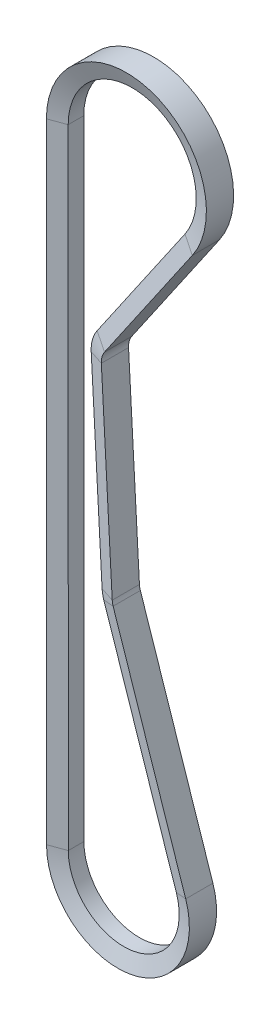
from build123d import *


with BuildPart() as part:
    # Sweep1: sweep along a path in Sketch2
    with BuildLine(Plane.XY) as sweep1_path:
        Line((-24.999999529, -0.004853431), (-25.042705751, 219.974686927))
        ThreePointArc((-25.042705751, 219.974686927), (11.26478038, 246.719338641), (26.024617616, 204.108810022))
        Line((26.024617616, 204.108810022), (-4.705730871, 159.445402954))
        ThreePointArc((-4.705730871, 159.445402954), (-5.587299935, 157.564983252), (-5.81499475, 155.500692249))
        Line((-5.81499475, 155.500692249), (-2.008276718, 85.604276763))
        ThreePointArc((-2.008276718, 85.604276763), (-1.90524448, 84.759976186), (-1.690298853, 83.937019635))
        Line((-1.690298853, 83.937019635), (23.71112417, 7.923546593))
        ThreePointArc((23.71112417, 7.923546593), (4.016239741, -24.675287604), (-24.999999529, -0.004853431))
    # Sketch3 → Sweep1 (sweep)
    with BuildSketch(Plane(origin=(23.71112417, 7.923546593, 0), x_dir=(-0.9484449667827561, -0.3169418637297014, 0), z_dir=(0.3169418637297014, -0.9484449667827561, 0))):
        Polygon((0, -4.7625), (0, 4.7625), (5.588, 2.728634331), (5.588, -2.728634331), align=None)
    sweep(path=sweep1_path.line)


solid = part.part
